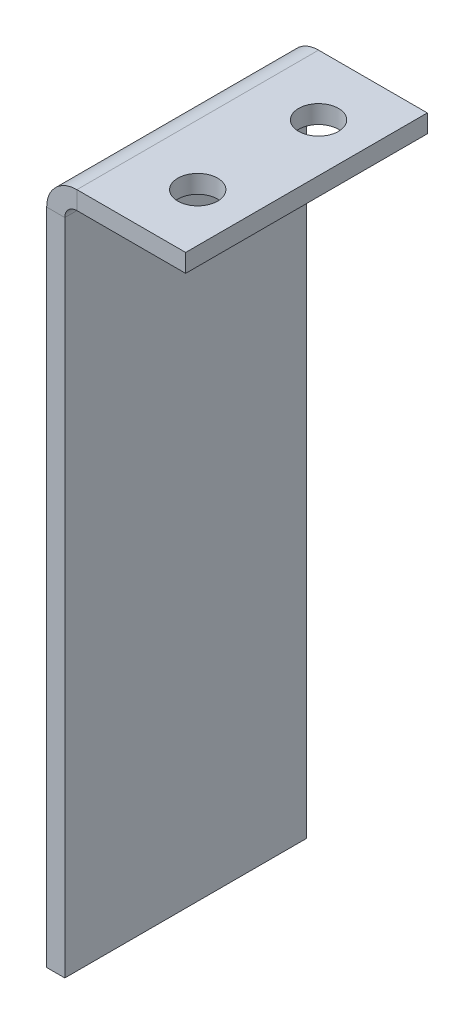
from build123d import *

# Parameters (mm, degrees)
SM_BASE_FLANGE_1_DEPTH = 10
HOLE_WIZARD_M4_1_D     = 3.3


# Sheet-metal steps are written as plain solids
with BuildPart() as part:
    # Sketch 1 → 基体-法兰1 (new, symmetric)
    with BuildSketch(Plane.XY):
        with BuildLine():
            Line((0, 0), (-9, 0))
            ThreePointArc((-9, 0), (-9.707106781, -0.292893219), (-10, -1))
            Line((-10, -1), (-10, -55.5))
            Line((-10, -55.5), (-11.5, -55.5))
            Line((-11.5, -55.5), (-11.5, -1))
            ThreePointArc((-11.5, -1), (-10.767766953, 0.767766953), (-9, 1.5))
            Line((-9, 1.5), (0, 1.5))
            Line((0, 1.5), (0, 0))
        make_face()
    extrude(amount=SM_BASE_FLANGE_1_DEPTH, both=True)

    # M4 螺纹孔1 (through all)
    with Locations(Plane(origin=(0, 1.5, 0), x_dir=(1, 0, 0), z_dir=(0, 1, 0))):
        with Locations((-4, 5), (-4, -5)):
            Hole(HOLE_WIZARD_M4_1_D / 2)


solid = part.part
